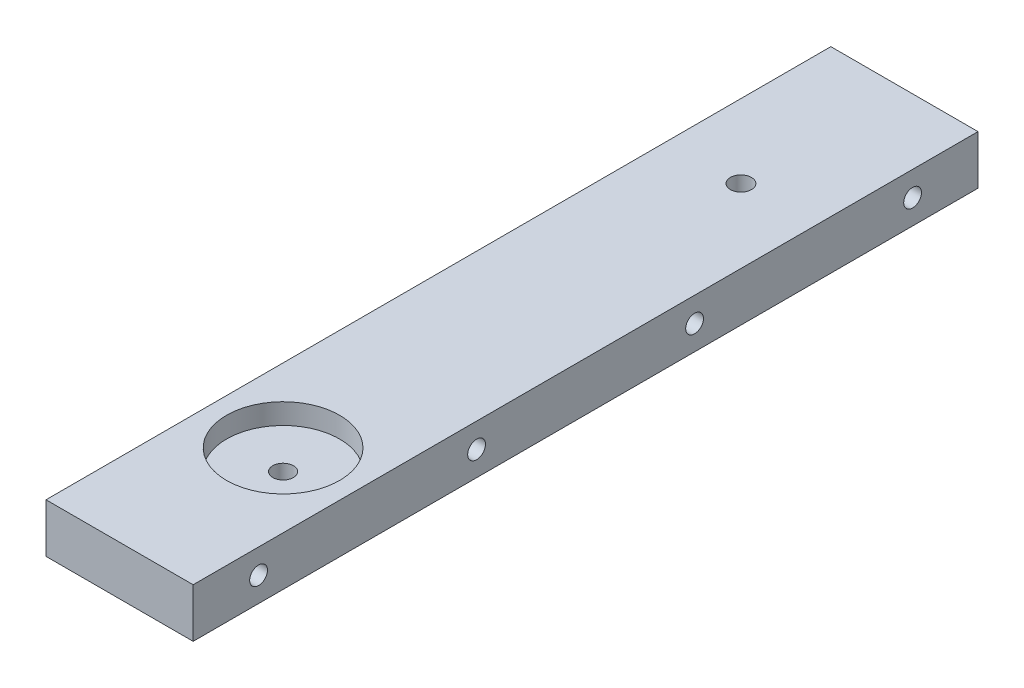
from build123d import *

# Parameters (mm, degrees)
SKETCH2_W                 = 28.575
SKETCH2_H                 = 152.4
BOSS_EXTRUDE1_DEPTH       = 9.525
LPATTERN1_COUNT           = 4
LPATTERN1_PITCH           = 42.333333333
LPATTERN2_COUNT           = 4
LPATTERN2_PITCH           = 42.333333333
F_5_CLEARANCE_HOLE5_D     = 3.4544
F_5_CLEARANCE_HOLE5_DEPTH = 12.7
F_5_CLEARANCE_HOLE5_TIP   = 1.037806461
SKETCH12_R                = 2.05
CUT_EXTRUDE1_DEPTH        = 156.348048749
SKETCH12_4_R              = 10.975
CUT_EXTRUDE2_DEPTH        = 4
SKETCH15_R                = 2
CUT_EXTRUDE3_DEPTH        = 156.154169296


with BuildPart() as part:
    # Sketch2 → Boss-Extrude1 (new body)
    with BuildSketch(Plane(origin=(0, 0, 0), x_dir=(1, 0, 0), z_dir=(0, 1, 0))):
        with Locations((14.2875, 76.2)):
            Rectangle(SKETCH2_W, SKETCH2_H)
    extrude(amount=BOSS_EXTRUDE1_DEPTH)

    # Sketch9 → #5 Clearance Hole3 (revolve, cut)
    with BuildSketch(Plane(origin=(0, 4.7625, -139.7), x_dir=(0, 0, 1), z_dir=(0, 1, 0))):
        Polygon((0, 0), (0, 13.737806461), (1.7272, 12.7), (1.7272, 0), align=None)
    f_5_clearance_hole3 = revolve(axis=Axis((-6.35, 4.7625, -139.7), (1, 0, 0)), mode=Mode.SUBTRACT)

    # LPattern1: #5 Clearance Hole3 ×4, 1 skipped
    with Locations(*[(0, 0, i * LPATTERN1_PITCH) for i in range(1, LPATTERN1_COUNT) if i not in (2,)]):
        add(f_5_clearance_hole3, mode=Mode.SUBTRACT)

    # Sketch11 → #5 Clearance Hole4 (revolve, cut)
    with BuildSketch(Plane(origin=(28.575, 4.7625, -12.7), x_dir=(0, 0, -1), z_dir=(0, 1, 0))):
        Polygon((0, 0), (0, 13.737806461), (1.7272, 12.7), (1.7272, 0), align=None)
    f_5_clearance_hole4 = revolve(axis=Axis((34.925, 4.7625, -12.7), (-1, 0, 0)), mode=Mode.SUBTRACT)

    # LPattern2: #5 Clearance Hole4 ×4
    with Locations(*[(0, 0, -i * LPATTERN2_PITCH) for i in range(1, LPATTERN2_COUNT)]):
        add(f_5_clearance_hole4, mode=Mode.SUBTRACT)

    # #5 Clearance Hole5
    with Locations(Plane.ZY):
        with Locations((-69.85, 4.7625)):
            Hole(F_5_CLEARANCE_HOLE5_D / 2, depth=F_5_CLEARANCE_HOLE5_DEPTH)
            with Locations((0, 0, -(F_5_CLEARANCE_HOLE5_DEPTH + F_5_CLEARANCE_HOLE5_TIP / 2))):  # 118° drill point
                Cone(0, F_5_CLEARANCE_HOLE5_D / 2, F_5_CLEARANCE_HOLE5_TIP, mode=Mode.SUBTRACT)

    # Sketch12 → Cut-Extrude1 (cut, through all)
    with BuildSketch(Plane(origin=(0, 9.525, 0), x_dir=(1, 0, 0), z_dir=(0, 1, 0))):
        with Locations((14.2875, 120.65)):
            Circle(SKETCH12_R)
    extrude(amount=-CUT_EXTRUDE1_DEPTH, mode=Mode.SUBTRACT)

    # Sketch12<4> → Cut-Extrude2 (cut)
    with BuildSketch(Plane(origin=(0, 9.525, 0), x_dir=(1, 0, 0), z_dir=(0, 1, 0))):
        with Locations((14.2875, 31.75)):
            Circle(SKETCH12_4_R)
    extrude(amount=-CUT_EXTRUDE2_DEPTH, mode=Mode.SUBTRACT)

    # Sketch15 → Cut-Extrude3 (cut, through all)
    with BuildSketch(Plane(origin=(0, 5.525, 0), x_dir=(1, 0, 0), z_dir=(0, 1, 0))):
        with Locations((14.2875, 31.75)):
            Circle(SKETCH15_R)
    extrude(amount=-CUT_EXTRUDE3_DEPTH, mode=Mode.SUBTRACT)


solid = part.part
